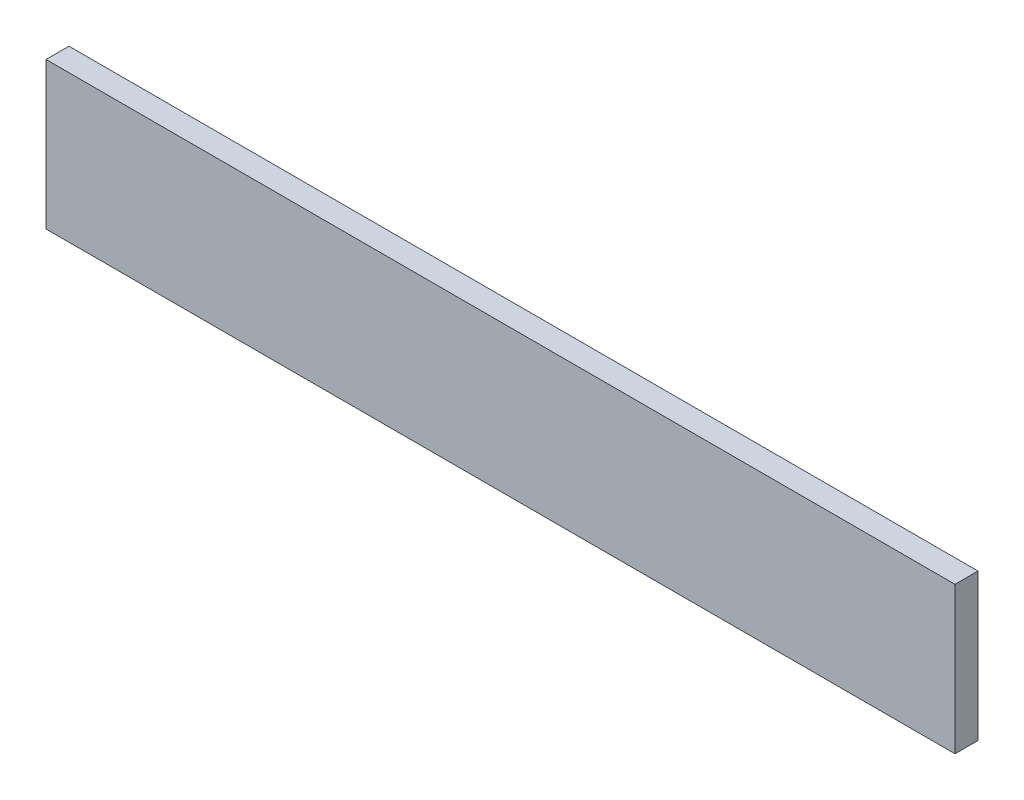
from build123d import *

# Parameters (mm, degrees)
CROQUIS1_W              = 712.15
CROQUIS1_H              = 115
SALIENTE_EXTRUIR1_DEPTH = 18


with BuildPart() as part:
    # Croquis1 → Saliente-Extruir1 (new body)
    with BuildSketch(Plane.XY):
        Rectangle(CROQUIS1_W, CROQUIS1_H)
    extrude(amount=SALIENTE_EXTRUIR1_DEPTH)


solid = part.part
